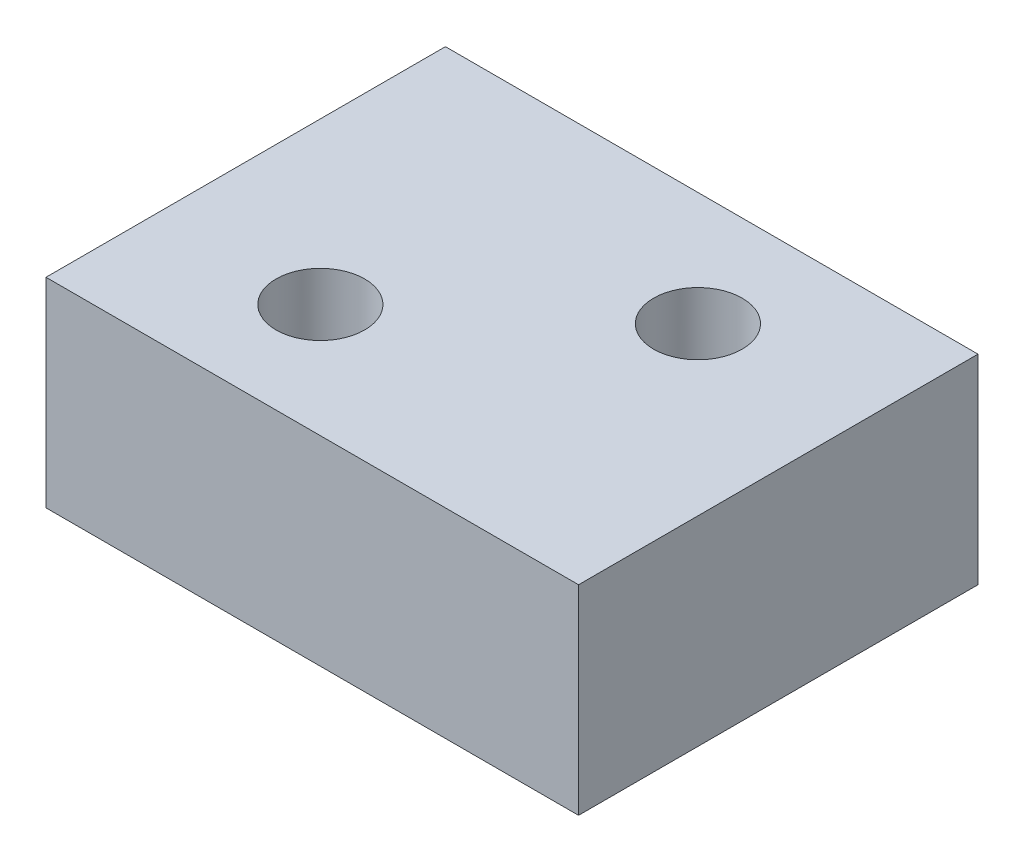
from build123d import *

# Parameters (mm, degrees)
SKETCH1_W               = 40
SKETCH1_H               = 30
BOSS_EXTRUDE1_DEPTH     = 10
SKETCH2_R               = 2
CUT_EXTRUDE1_DEPTH      = 5
SKETCH3_R               = 4.8125
CUT_EXTRUDE2_DEPTH      = 4
SKETCH5_W               = 40
SKETCH5_H               = 30
BOSS_EXTRUDE2_DEPTH     = 5
CUT_EXTRUDE3_DEPTH      = 27.570660511
CUT_EXTRUDE3_DEPTH_BACK = 1
SKETCH4_R               = 3.325


with BuildPart() as part:
    # Sketch1 → Boss-Extrude1 (new body)
    with BuildSketch(Plane(origin=(0, 0, 0), x_dir=(1, 0, 0), z_dir=(0, 1, 0))):
        Rectangle(SKETCH1_W, SKETCH1_H)
    extrude(amount=BOSS_EXTRUDE1_DEPTH)

    # Sketch2 → Cut-Extrude1 (cut)
    with BuildSketch(Plane(origin=(0, 0, 0), x_dir=(-1, 0, 0), z_dir=(0, -1, 0))):
        with Locations((-13.333333333, -10)):
            Circle(SKETCH2_R)
        with Locations((13.333333333, -10)):
            Circle(SKETCH2_R)
        with Locations((-13.333333333, 10)):
            Circle(SKETCH2_R)
        with Locations((13.333333333, 10)):
            Circle(SKETCH2_R)
    extrude(amount=-CUT_EXTRUDE1_DEPTH, mode=Mode.SUBTRACT)

    # Sketch3 → Cut-Extrude2 (cut)
    with BuildSketch(Plane(origin=(0, 10, 0), x_dir=(1, 0, 0), z_dir=(0, 1, 0))):
        with Locations((-7.9286, -6.465)):
            Circle(SKETCH3_R)
        with Locations((7.5, 6.4636)):
            Circle(SKETCH3_R)
    extrude(amount=-CUT_EXTRUDE2_DEPTH, mode=Mode.SUBTRACT)

    # Sketch5 → Boss-Extrude2 (add)
    with BuildSketch(Plane(origin=(0, 10, 0), x_dir=(1, 0, 0), z_dir=(0, 1, 0))):
        Rectangle(SKETCH5_W, SKETCH5_H)
    extrude(amount=BOSS_EXTRUDE2_DEPTH)

    # Sketch4 → Cut-Extrude3 (cut, two sides: drawn at the far end of the back side and taken through both)
    with BuildSketch(Plane(origin=(0, 6, 0), x_dir=(1, 0, 0), z_dir=(0, 1, 0)).offset(-CUT_EXTRUDE3_DEPTH_BACK)):
        with Locations((-7.9286, -6.465)):
            Circle(SKETCH4_R)
        with Locations((7.5, 6.4636)):
            Circle(SKETCH4_R)
    extrude(amount=CUT_EXTRUDE3_DEPTH + CUT_EXTRUDE3_DEPTH_BACK, mode=Mode.SUBTRACT)


solid = part.part
